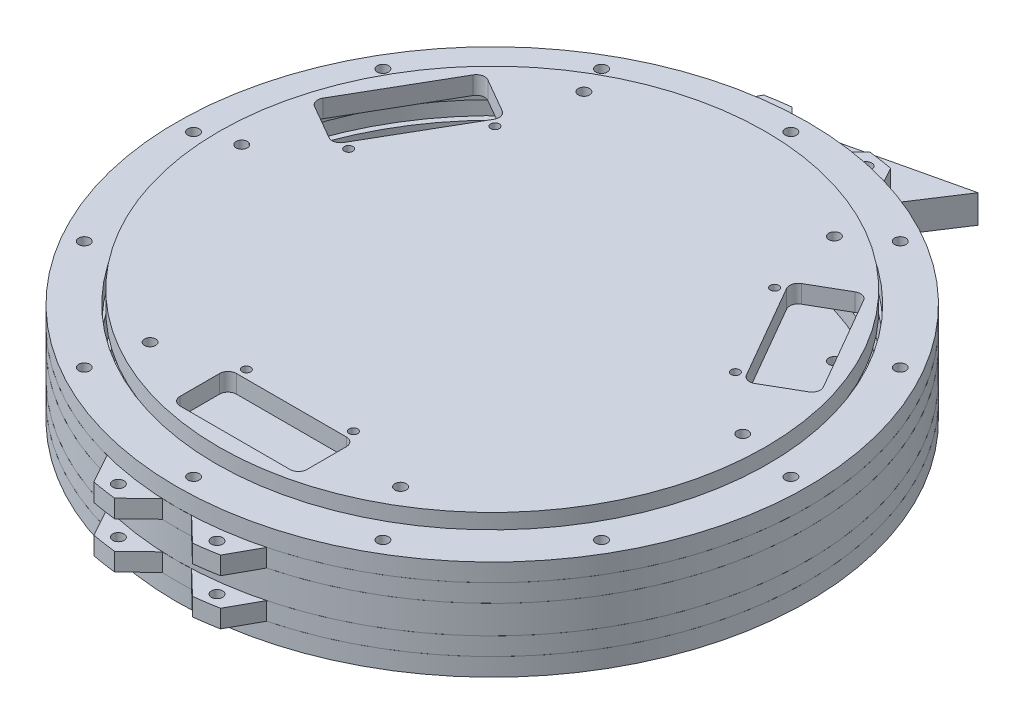
from build123d import *

# Parameters (mm, degrees)
SKETCH3_W                  = 14
SKETCH3_H                  = 6.35
SKETCH3_3_W                = 12
SKETCH3_3_H                = 6.35
BOSS_EXTRUDE1_START        = -16
SKETCH5_R                  = 97
SKETCH5_R_2                = 2
BOSS_EXTRUDE1_DEPTH        = 6.35
SKETCH6_R                  = 2.15
CUT_EXTRUDE1_DEPTH         = 6.35
SKETCH6_4_W                = 45
SKETCH6_4_H                = 20
CUT_EXTRUDE5_DEPTH         = 165.578522293
SKETCH8_R                  = 1.5
CUT_EXTRUDE4_DEPTH         = 160.96100306
CIRPATTERN1_COUNT          = 3
BOSS_EXTRUDE6_START        = -16
BOSS_EXTRUDE6_OUTLINE_R    = 5
BOSS_EXTRUDE6_DEPTH        = 32
SKETCH9_R                  = 2.15
CUT_EXTRUDE3_DEPTH         = 163.968470877
BOSS_EXTRUDE7_START        = 5
BOSS_EXTRUDE7_OUTLINE_R    = 2
BOSS_EXTRUDE7_DEPTH        = 6.35
BOSS_EXTRUDE8_START        = -11.35
BOSS_EXTRUDE8_OUTLINE_R    = 2
BOSS_EXTRUDE8_DEPTH        = 6.35
SKETCH12_R                 = 2
CUT_EXTRUDE6_DEPTH         = 170.108804267
CIRPATTERN4_COUNT          = 12
FILLET1_R                  = 3
FILLET2_R                  = 3
BOSS_EXTRUDE10_START       = -6.35
SKETCH14_R                 = 2
BOSS_EXTRUDE10_DEPTH       = 10
SKETCH13_R                 = 8.2
SKETCH13_R_2               = 5.2
BOSS_EXTRUDE9_DEPTH        = 5
BOSS_EXTRUDE11_START       = 11.35
BOSS_EXTRUDE11_OUTLINE_R   = 8.2
BOSS_EXTRUDE11_OUTLINE_R_2 = 5.2
BOSS_EXTRUDE11_DEPTH       = 4.65


# Read off the part's stored shape, not the designer's step: Boss-Extrude6, Boss-Extrude7, Boss-Extrude8, Boss-Extrude11
with BuildPart() as part:
    # Sketch3 → Revolve1 (revolve)
    with BuildSketch(Plane.XY, mode=Mode.PRIVATE) as revolve1_sk:
        Polygon((-98, -17.7), (-98, -11.35), (-100, -11.35), (-112, -11.35), (-112, -17.7), align=None)
        Polygon((-112, -5), (-112, 5), (-100, 5), (-98, 5), (-98, -5), align=None)
        with Locations((-105, 14.525)):
            Rectangle(SKETCH3_W, SKETCH3_H)
    revolve(revolve1_sk.sketch.rotate(Axis((0, 55, 0), (0, -1, 0)), 270), axis=Axis((0, 55, 0), (0, -1, 0)))


with BuildPart() as body_2:
    # Sketch3<3> → Revolve2 (revolve)
    with BuildSketch(Plane.XY, mode=Mode.PRIVATE) as revolve2_sk:
        with Locations((-106, -8.175)):
            Rectangle(SKETCH3_3_W, SKETCH3_3_H)
        with Locations((-106, 8.175)):
            Rectangle(SKETCH3_3_W, SKETCH3_3_H)
    revolve(revolve2_sk.sketch.rotate(Axis((0, 55, 0), (0, -1, 0)), 270), axis=Axis((0, 55, 0), (0, -1, 0)))

    # Boss-Extrude7 outline → Boss-Extrude7 (add)
    # profile 1 of 4: a face of its own
    with BuildSketch(Plane(origin=(0, 0, 0), x_dir=(1, 0, 0), z_dir=(0, 1, 0)).offset(BOSS_EXTRUDE7_START)):
        with BuildLine():
            ThreePointArc((-22.5, -118.889654722), (-18.175965665, -119.627063293), (-13.828044672, -120.207259267))
            Line((-13.828044672, -120.207259267), (-5.187837736, -111.879785214))
            ThreePointArc((-5.187837736, -111.879785214), (-16.824034335, -110.729182552), (-28.276855185, -108.371672779))
            Line((-28.276855185, -108.371672779), (-22.5, -118.889654722))
        make_face()
        with Locations((-17.5, -115.178122923)):
            Circle(BOSS_EXTRUDE7_OUTLINE_R, mode=Mode.SUBTRACT)
    # profile 2 of 4: a face of its own
    with BuildSketch(Plane(origin=(0, 0, 0), x_dir=(1, 0, 0), z_dir=(0, 1, 0)).offset(BOSS_EXTRUDE7_START)):
        with BuildLine():
            ThreePointArc((28.276855185, -108.371672779), (16.824034335, -110.729182552), (5.187837736, -111.879785214))
            Line((5.187837736, -111.879785214), (13.828044672, -120.207259267))
            ThreePointArc((13.828044672, -120.207259267), (18.175965665, -119.627063293), (22.5, -118.889654722))
            Line((22.5, -118.889654722), (28.276855185, -108.371672779))
        make_face()
        with Locations((17.5, -115.178122923)):
            Circle(BOSS_EXTRUDE7_OUTLINE_R, mode=Mode.SUBTRACT)
    # profile 3 of 4: a face of its own
    with BuildSketch(Plane(origin=(0, 0, 0), x_dir=(1, 0, 0), z_dir=(0, 1, 0)).offset(BOSS_EXTRUDE7_START)):
        with BuildLine():
            Line((-22.5, 118.889654722), (-28.276855185, 108.371672779))
            ThreePointArc((-28.276855185, 108.371672779), (-16.824034335, 110.729182552), (-5.187837736, 111.879785214))
            Line((-5.187837736, 111.879785214), (-13.828044672, 120.207259267))
            ThreePointArc((-13.828044672, 120.207259267), (-18.175965665, 119.627063293), (-22.5, 118.889654722))
        make_face()
        with Locations((-17.5, 115.178122923)):
            Circle(BOSS_EXTRUDE7_OUTLINE_R, mode=Mode.SUBTRACT)
    # profile 4 of 4: a face of its own
    with BuildSketch(Plane(origin=(0, 0, 0), x_dir=(1, 0, 0), z_dir=(0, 1, 0)).offset(BOSS_EXTRUDE7_START)):
        with BuildLine():
            Line((13.828044672, 120.207259267), (5.187837736, 111.879785214))
            ThreePointArc((5.187837736, 111.879785214), (16.824034335, 110.729182552), (28.276855185, 108.371672779))
            Line((28.276855185, 108.371672779), (22.5, 118.889654722))
            ThreePointArc((22.5, 118.889654722), (18.175965665, 119.627063293), (13.828044672, 120.207259267))
        make_face()
        with Locations((17.5, 115.178122923)):
            Circle(BOSS_EXTRUDE7_OUTLINE_R, mode=Mode.SUBTRACT)
    extrude(amount=BOSS_EXTRUDE7_DEPTH)

    # Boss-Extrude8 outline → Boss-Extrude8 (add)
    # profile 1 of 4: a face of its own
    with BuildSketch(Plane(origin=(0, 0, 0), x_dir=(1, 0, 0), z_dir=(0, 1, 0)).offset(BOSS_EXTRUDE8_START)):
        with BuildLine():
            ThreePointArc((-22.5, -118.889654722), (-18.175965665, -119.627063293), (-13.828044672, -120.207259267))
            Line((-13.828044672, -120.207259267), (-5.187837736, -111.879785214))
            ThreePointArc((-5.187837736, -111.879785214), (-16.824034335, -110.729182552), (-28.276855185, -108.371672779))
            Line((-28.276855185, -108.371672779), (-22.5, -118.889654722))
        make_face()
        with Locations((-17.5, -115.178122923)):
            Circle(BOSS_EXTRUDE8_OUTLINE_R, mode=Mode.SUBTRACT)
    # profile 2 of 4: a face of its own
    with BuildSketch(Plane(origin=(0, 0, 0), x_dir=(1, 0, 0), z_dir=(0, 1, 0)).offset(BOSS_EXTRUDE8_START)):
        with BuildLine():
            ThreePointArc((28.276855185, -108.371672779), (16.824034335, -110.729182552), (5.187837736, -111.879785214))
            Line((5.187837736, -111.879785214), (13.828044672, -120.207259267))
            ThreePointArc((13.828044672, -120.207259267), (18.175965665, -119.627063293), (22.5, -118.889654722))
            Line((22.5, -118.889654722), (28.276855185, -108.371672779))
        make_face()
        with Locations((17.5, -115.178122923)):
            Circle(BOSS_EXTRUDE8_OUTLINE_R, mode=Mode.SUBTRACT)
    # profile 3 of 4: a face of its own
    with BuildSketch(Plane(origin=(0, 0, 0), x_dir=(1, 0, 0), z_dir=(0, 1, 0)).offset(BOSS_EXTRUDE8_START)):
        with BuildLine():
            Line((-22.5, 118.889654722), (-28.276855185, 108.371672779))
            ThreePointArc((-28.276855185, 108.371672779), (-16.824034335, 110.729182552), (-5.187837736, 111.879785214))
            Line((-5.187837736, 111.879785214), (-13.828044672, 120.207259267))
            ThreePointArc((-13.828044672, 120.207259267), (-18.175965665, 119.627063293), (-22.5, 118.889654722))
        make_face()
        with Locations((-17.5, 115.178122923)):
            Circle(BOSS_EXTRUDE8_OUTLINE_R, mode=Mode.SUBTRACT)
    # profile 4 of 4: a face of its own
    with BuildSketch(Plane(origin=(0, 0, 0), x_dir=(1, 0, 0), z_dir=(0, 1, 0)).offset(BOSS_EXTRUDE8_START)):
        with BuildLine():
            Line((13.828044672, 120.207259267), (5.187837736, 111.879785214))
            ThreePointArc((5.187837736, 111.879785214), (16.824034335, 110.729182552), (28.276855185, 108.371672779))
            Line((28.276855185, 108.371672779), (22.5, 118.889654722))
            ThreePointArc((22.5, 118.889654722), (18.175965665, 119.627063293), (13.828044672, 120.207259267))
        make_face()
        with Locations((17.5, 115.178122923)):
            Circle(BOSS_EXTRUDE8_OUTLINE_R, mode=Mode.SUBTRACT)
    extrude(amount=BOSS_EXTRUDE8_DEPTH)


with BuildPart() as body_3:
    # Sketch5 → Boss-Extrude1 (new body)
    with BuildSketch(Plane(origin=(0, 0, 0), x_dir=(1, 0, 0), z_dir=(0, 1, 0)).offset(BOSS_EXTRUDE1_START)):
        with Locations(Location((0, 0, 0), (0, 0, 270))):
            Circle(SKETCH5_R)
        with Locations(Location((-44.45, 76.989658396, 0), (0, 0, 270))):
            Circle(SKETCH5_R_2, mode=Mode.SUBTRACT)
        with Locations(Location((-88.9, 0, 0), (0, 0, 270))):
            Circle(SKETCH5_R_2, mode=Mode.SUBTRACT)
        with Locations(Location((-44.45, -76.989658396, 0), (0, 0, 270))):
            Circle(SKETCH5_R_2, mode=Mode.SUBTRACT)
        with Locations(Location((44.45, 76.989658396, 0), (0, 0, 270))):
            Circle(SKETCH5_R_2, mode=Mode.SUBTRACT)
        with Locations(Location((88.9, 0, 0), (0, 0, 270))):
            Circle(SKETCH5_R_2, mode=Mode.SUBTRACT)
        with Locations(Location((44.45, -76.989658396, 0), (0, 0, 270))):
            Circle(SKETCH5_R_2, mode=Mode.SUBTRACT)
    extrude(amount=-BOSS_EXTRUDE1_DEPTH)


with BuildPart() as body_4:
    # Mirror1: mirrored copy
    add(body_3.part.mirror(Plane.ZX))


with BuildPart() as body_3_1:
    add(body_3.part)

    # Sketch6 → Cut-Extrude1 (cut)
    with BuildSketch(Plane(origin=(0, -22.35, 0), x_dir=(-1, 0, 0), z_dir=(0, -1, 0))):
        with Locations(Location((-5.656854249, 87.256854249, 0), (0, 0, 90))):
            Circle(SKETCH6_R)
        with Locations(Location((5.656854249, 87.256854249, 0), (0, 0, 90))):
            Circle(SKETCH6_R)
        with Locations(Location((-5.656854249, 75.943145751, 0), (0, 0, 90))):
            Circle(SKETCH6_R)
        with Locations(Location((5.656854249, 75.943145751, 0), (0, 0, 90))):
            Circle(SKETCH6_R)
    cut_extrude1 = extrude(amount=-CUT_EXTRUDE1_DEPTH, mode=Mode.SUBTRACT)


with BuildPart() as cut_extrude5_tool:
    # Sketch6<4> → Cut-Extrude5 (new, symmetric)
    with BuildSketch(Plane(origin=(0, -22.35, 0), x_dir=(-1, 0, 0), z_dir=(0, -1, 0))):
        with Locations((0, -81.267464082)):
            Rectangle(SKETCH6_4_W, SKETCH6_4_H)
    cut_extrude5 = extrude(amount=CUT_EXTRUDE5_DEPTH, both=True)


with BuildPart() as body_3_2:
    add(body_3_1.part)

    # Cut-Extrude5: cut by cut_extrude5_tool
    add(cut_extrude5_tool.part, mode=Mode.SUBTRACT)


with BuildPart() as body_4_1:
    add(body_4.part)

    # Cut-Extrude5: cut by cut_extrude5_tool
    add(cut_extrude5_tool.part, mode=Mode.SUBTRACT)


with BuildPart() as cut_extrude4_tool:
    # Sketch8 → Cut-Extrude4 (new, symmetric)
    with BuildSketch(Plane(origin=(0, 0, 0), x_dir=(1, 0, 0), z_dir=(0, 1, 0))):
        with Locations(Location((-19, -68.267464082, 0), (0, 0, 270))):
            Circle(SKETCH8_R)
        with Locations(Location((19, -68.267464082, 0), (0, 0, 270))):
            Circle(SKETCH8_R)
    cut_extrude4 = extrude(amount=CUT_EXTRUDE4_DEPTH, both=True)


with BuildPart() as body_3_3:
    add(body_3_2.part)

    # Cut-Extrude4: cut by cut_extrude4_tool
    add(cut_extrude4_tool.part, mode=Mode.SUBTRACT)


with BuildPart() as body_4_2:
    add(body_4_1.part)

    # Cut-Extrude4: cut by cut_extrude4_tool
    add(cut_extrude4_tool.part, mode=Mode.SUBTRACT)


with BuildPart() as cirpattern1_tool:
    # CirPattern1: Cut-Extrude1, Cut-Extrude5, Cut-Extrude4 ×3 about axis
    cirpattern1_axis = Axis((0, 0, 0), (0, 1, 0))
    add([cut_extrude1.rotate(cirpattern1_axis, i * 360 / CIRPATTERN1_COUNT) for i in range(1, CIRPATTERN1_COUNT)])
    add([cut_extrude5.rotate(cirpattern1_axis, i * 360 / CIRPATTERN1_COUNT) for i in range(1, CIRPATTERN1_COUNT)])
    add([cut_extrude4.rotate(cirpattern1_axis, i * 360 / CIRPATTERN1_COUNT) for i in range(1, CIRPATTERN1_COUNT)])


with BuildPart() as body_3_4:
    add(body_3_3.part)

    # CirPattern1: cut by cirpattern1_tool
    add(cirpattern1_tool.part, mode=Mode.SUBTRACT)

    # Fillet2
    fillet2_edges = [body_3_4.edges().sort_by_distance(p)[0] for p in [
        (-72.969434359, -19.175, -16.148160456),
        (-50.469434359, -19.175, -55.119303626),
        (-67.789942434, -19.175, -65.119303626),
        (-90.289942434, -19.175, -26.148160456),
        (50.469434359, -19.175, -55.119303626),
        (72.969434359, -19.175, -16.148160456),
        (90.289942434, -19.175, -26.148160456),
        (67.789942434, -19.175, -65.119303626),
        (22.5, -19.175, 71.267464082),
        (-22.5, -19.175, 71.267464082),
        (-22.5, -19.175, 91.267464082),
        (22.5, -19.175, 91.267464082),
    ]]
    fillet(fillet2_edges, radius=FILLET2_R)


with BuildPart() as body_4_3:
    add(body_4_2.part)

    # CirPattern1: cut by cirpattern1_tool
    add(cirpattern1_tool.part, mode=Mode.SUBTRACT)

    # Fillet1
    fillet1_edges = [body_4_3.edges().sort_by_distance(p)[0] for p in [
        (22.5, 19.175, 71.267464082),
        (-22.5, 19.175, 71.267464082),
        (-22.5, 19.175, 91.267464082),
        (22.5, 19.175, 91.267464082),
        (-72.969434359, 19.175, -16.148160456),
        (-50.469434359, 19.175, -55.119303626),
        (-67.789942434, 19.175, -65.119303626),
        (-90.289942434, 19.175, -26.148160456),
        (50.469434359, 19.175, -55.119303626),
        (72.969434359, 19.175, -16.148160456),
        (90.289942434, 19.175, -26.148160456),
        (67.789942434, 19.175, -65.119303626),
    ]]
    fillet(fillet1_edges, radius=FILLET1_R)


with BuildPart() as body_5:
    # Boss-Extrude6 outline → Boss-Extrude6 (new body)
    with BuildSketch(Plane(origin=(0, 0, 0), x_dir=(1, 0, 0), z_dir=(0, 1, 0)).offset(BOSS_EXTRUDE6_START)):
        with Locations((-88.9, 0)):
            Circle(BOSS_EXTRUDE6_OUTLINE_R)
    extrude(amount=BOSS_EXTRUDE6_DEPTH)

    # Sketch9 → Cut-Extrude3 (cut, through all)
    with BuildSketch(Plane(origin=(0, -16, 0), x_dir=(-1, 0, 0), z_dir=(0, -1, 0))):
        with Locations(Location((88.9, 0, 0), (0, 0, 90))):
            Circle(SKETCH9_R)
    extrude(amount=-CUT_EXTRUDE3_DEPTH, mode=Mode.SUBTRACT)


with BuildPart() as cut_extrude6_tool:
    # Sketch12 → Cut-Extrude6 (new, through all)
    with BuildSketch(Plane(origin=(0, 17.7, 0), x_dir=(1, 0, 0), z_dir=(0, 1, 0))):
        with Locations(Location((-106, 0, 0), (0, 0, 270))):
            Circle(SKETCH12_R)
    cut_extrude6 = extrude(amount=-CUT_EXTRUDE6_DEPTH)


with BuildPart() as part_1:
    add(part.part)

    # Cut-Extrude6: cut by cut_extrude6_tool
    add(cut_extrude6_tool.part, mode=Mode.SUBTRACT)


with BuildPart() as body_2_1:
    add(body_2.part)

    # Cut-Extrude6: cut by cut_extrude6_tool
    add(cut_extrude6_tool.part, mode=Mode.SUBTRACT)


with BuildPart() as cirpattern4_tool:
    # CirPattern4: Cut-Extrude6 ×12 about axis
    cirpattern4_axis = Axis((0, 0, 0), (0, 1, 0))
    for i in range(1, CIRPATTERN4_COUNT):
        add(cut_extrude6.rotate(cirpattern4_axis, i * 360 / CIRPATTERN4_COUNT))


with BuildPart() as part_2:
    add(part_1.part)

    # CirPattern4: cut by cirpattern4_tool
    add(cirpattern4_tool.part, mode=Mode.SUBTRACT)


with BuildPart() as body_2_2:
    add(body_2_1.part)

    # CirPattern4: cut by cirpattern4_tool
    add(cirpattern4_tool.part, mode=Mode.SUBTRACT)


with BuildPart() as body_6:
    # Sketch14 → Boss-Extrude10 (new body)
    with BuildSketch(Plane(origin=(0, 11.35, 0), x_dir=(1, 0, 0), z_dir=(0, 1, 0)).offset(BOSS_EXTRUDE10_START)):
        with BuildLine():
            Line((-23.537955262, 109.703257299), (-22.5, 118.889654722))
            Line((-22.5, 118.889654722), (39.168918016, 133.240342601))
            Line((39.168918016, 133.240342601), (23.758816813, 109.655636534))
            ThreePointArc((23.758816813, 109.655636534), (0.112968538, 112.199943129), (-23.537955262, 109.703257299))
        make_face()
        with Locations(Location((-17.5, 115.178122923, 0), (0, 0, 270))):
            Circle(SKETCH14_R, mode=Mode.SUBTRACT)
        with Locations(Location((17.5, 115.178122923, 0), (0, 0, 270))):
            Circle(SKETCH14_R, mode=Mode.SUBTRACT)
    extrude(amount=-BOSS_EXTRUDE10_DEPTH)


with BuildPart() as body_7:
    # Sketch13 → Boss-Extrude9 (new, symmetric)
    with BuildSketch(Plane(origin=(0, 0, 0), x_dir=(1, 0, 0), z_dir=(0, 1, 0))):
        with Locations(Location((-88.9, 0, 0), (0, 0, 270))):
            Circle(SKETCH13_R)
        with Locations(Location((-88.9, 0, 0), (0, 0, 270))):
            Circle(SKETCH13_R_2, mode=Mode.SUBTRACT)
    extrude(amount=BOSS_EXTRUDE9_DEPTH, both=True)


with BuildPart() as body_8:
    # Boss-Extrude11 outline → Boss-Extrude11 (new body)
    with BuildSketch(Plane(origin=(0, 0, 0), x_dir=(1, 0, 0), z_dir=(0, 1, 0)).offset(BOSS_EXTRUDE11_START)):
        with Locations((-88.9, 0)):
            Circle(BOSS_EXTRUDE11_OUTLINE_R)
        with Locations((-88.9, 0)):
            Circle(BOSS_EXTRUDE11_OUTLINE_R_2, mode=Mode.SUBTRACT)
    extrude(amount=BOSS_EXTRUDE11_DEPTH)


solid = Compound([body_3_4.part, body_4_3.part, body_5.part, part_2.part, body_2_2.part, body_6.part, body_7.part, body_8.part])
